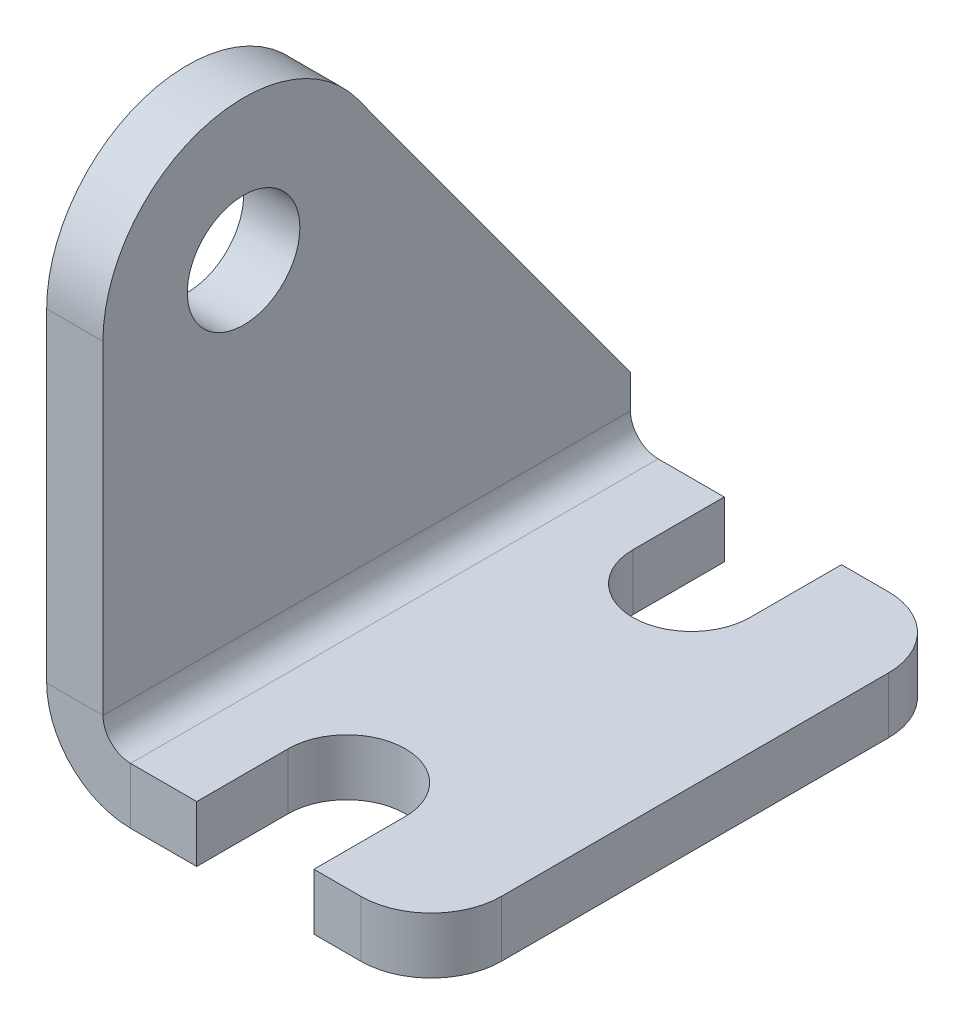
from build123d import *

# Parameters (mm, degrees)
SKETCH1_R              = 3.048
BOSS_EXTRUDE1_DEPTH    = 3.048
SKETCH2_W              = 28.575
SKETCH2_H              = 3.048
BOSS_EXTRUDE2_DEPTH    = 17.78
CUT_EXTRUDE1_DEPTH     = 45.290237175
FILLET1_R              = 3.81
CONVERT_SOLID1_START   = -28.575
CONVERT_SOLID1_DEPTH   = 28.575
CONVERT_SOLID1_2_DEPTH = 28.575


# Read off the part's stored shape, not the designer's step: Convert-Solid1
with BuildPart() as part:
    # Sketch1 → Boss-Extrude1 (new body)
    with BuildSketch(Plane(origin=(0, 0, 0), x_dir=(0, 0, -1), z_dir=(1, 0, 0))):
        with BuildLine():
            Line((28.575, 6.35), (13.771011503, 26.59571692))
            ThreePointArc((13.771011503, 26.59571692), (5.254234548, 29.341449028), (0, 22.098))
            Line((0, 22.098), (0, 0))
            Line((0, 0), (28.575, 0))
            Line((28.575, 0), (28.575, 6.35))
        make_face()
        with Locations(Location((7.62, 22.098, 0), (0, 0, 180))):
            Circle(SKETCH1_R, mode=Mode.SUBTRACT)
    extrude(amount=BOSS_EXTRUDE1_DEPTH)

    # Sketch2 → Boss-Extrude2 (add)
    with BuildSketch(Plane(origin=(3.048, 0, 0), x_dir=(0, 0, -1), z_dir=(1, 0, 0))):
        with Locations((14.2875, 1.524)):
            Rectangle(SKETCH2_W, SKETCH2_H)
    extrude(amount=BOSS_EXTRUDE2_DEPTH)

    # Sketch3 → Cut-Extrude1 (cut, through all)
    with BuildSketch(Plane(origin=(0, 3.048, 0), x_dir=(1, 0, 0), z_dir=(0, 1, 0))):
        with BuildLine():
            Line((8.128, 4.953), (8.128, 0))
            Line((8.128, 0), (14.478, 0))
            Line((14.478, 0), (14.478, 4.953))
            ThreePointArc((14.478, 4.953), (11.303, 8.128), (8.128, 4.953))
        make_face()
        with BuildLine():
            Line((8.128, 28.575), (8.128, 23.622))
            ThreePointArc((8.128, 23.622), (11.303, 20.447), (14.478, 23.622))
            Line((14.478, 23.622), (14.478, 28.575))
            Line((14.478, 28.575), (8.128, 28.575))
        make_face()
    extrude(amount=-CUT_EXTRUDE1_DEPTH, mode=Mode.SUBTRACT)

    # Fillet1
    fillet1_edges = [part.edges().sort_by_distance(p)[0] for p in [
        (20.828, 1.524, 0),
        (20.828, 1.524, -28.575),
    ]]
    fillet(fillet1_edges, radius=FILLET1_R)

    # Convert-Solid1 outline → Convert-Solid1 (cut)
    with BuildSketch(Plane.XY.offset(CONVERT_SOLID1_START)):
        with BuildLine():
            Line((0, 0), (4.548, 0))
            ThreePointArc((4.548, 0), (1.332078359, 1.332078359), (0, 4.548))
            Line((0, 4.548), (0, 0))
        make_face()
    extrude(amount=CONVERT_SOLID1_DEPTH, mode=Mode.SUBTRACT)

    # Convert-Solid1 2 outline → Convert-Solid1 2 (add)
    with BuildSketch(Plane.XY.offset(CONVERT_SOLID1_START)):
        with BuildLine():
            Line((3.048, 3.048), (4.548, 3.048))
            ThreePointArc((4.548, 3.048), (3.487339828, 3.487339828), (3.048, 4.548))
            Line((3.048, 4.548), (3.048, 3.048))
        make_face()
    extrude(amount=CONVERT_SOLID1_2_DEPTH)


solid = part.part
